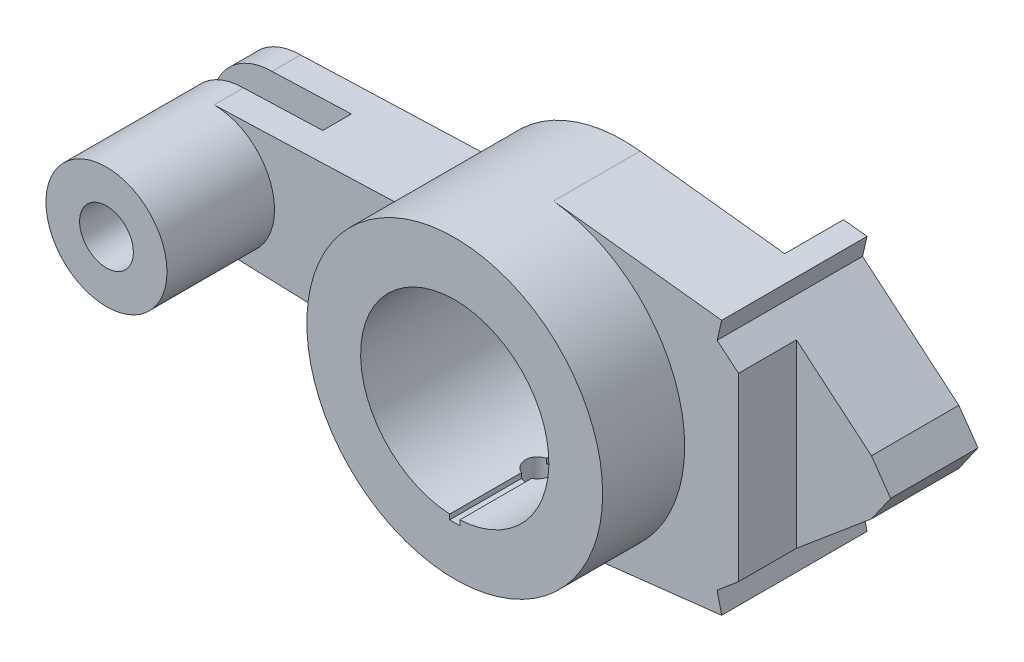
from build123d import *
from OCP.BRepAlgoAPI import BRepAlgoAPI_Cut
from OCP.TopTools import TopTools_ListOfShape

# Parameters (mm, degrees)
BOSS_EXTRUDE7_DEPTH     = 20.6375
SKETCH1_18_R            = 14.2875
SKETCH1_18_R_2          = 6.35
SKETCH1_18_R_3          = 34.925
SKETCH1_18_R_4          = 22.225
BOSS_EXTRUDE10_DEPTH    = 6.746875
BOSS_EXTRUDE11_START    = 6.746875
SKETCH1_20_R            = 34.925
SKETCH1_20_R_2          = 22.225
BOSS_EXTRUDE11_DEPTH    = 6.746875
BOSS_EXTRUDE12_START    = 13.692187
SKETCH1_21_R            = 14.2875
SKETCH1_21_R_2          = 6.35
SKETCH1_21_R_3          = 34.925
SKETCH1_21_R_4          = 22.225
BOSS_EXTRUDE12_DEPTH    = 6.945312
BOSS_EXTRUDE13_START    = 39.09219
SKETCH1_22_R            = 14.2875
SKETCH1_22_R_2          = 6.35
BOSS_EXTRUDE13_DEPTH    = 25.4
BOSS_EXTRUDE14_START    = 13.692187
SKETCH1_23_R            = 34.925
SKETCH1_23_R_2          = 22.225
BOSS_EXTRUDE14_DEPTH    = 19.367501
CUT_EXTRUDE3_DEPTH      = 111.865374
SKETCH5_R               = 3.175
CUT_EXTRUDE4_DEPTH      = 105.575057
CUT_EXTRUDE5_DEPTH      = 105.575057
CUT_EXTRUDE5_DEPTH_BACK = 105.575057
SKETCH6_W               = 33.02
SKETCH6_H               = 6.746875


with BuildPart() as part:
    # Sketch1 → Boss-Extrude7 (new body)
    with BuildSketch(Plane.XY):
        Polygon((38.1, 30.797578), (38.1, -30.797578), (43.65625, -30.1625), (42.588827, -25.538982), (65.327211, -6.459212), (69.85, 0), (65.327211, 6.459212), (42.588827, 25.538982), (43.65625, 30.1625), align=None)
    extrude(amount=-BOSS_EXTRUDE7_DEPTH)

    # Sketch1<18> → Boss-Extrude10 (add)
    # profile 1 of 5: a face of its own
    with BuildSketch(Plane.XY):
        with BuildLine():
            ThreePointArc((34.925, 0), (26.060233, -23.251234), (3.966094, -34.699074))
            Line((3.966094, -34.699074), (38.1, -30.797578))
            Line((38.1, -30.797578), (38.1, 30.797578))
            Line((38.1, 30.797578), (3.966094, 34.699074))
            ThreePointArc((3.966094, 34.699074), (26.060233, 23.251234), (34.925, 0))
        make_face()
    # profile 2 of 5: a face of its own
    with BuildSketch(Plane.XY):
        with BuildLine():
            Line((-55.5625, 15.014068), (-55.5625, -15.014068))
            Line((-55.5625, -15.014068), (-31.10852, -15.875))
            ThreePointArc((-31.10852, -15.875), (-34.925, 0), (-31.10852, 15.875))
            Line((-31.10852, 15.875), (-55.5625, 15.014068))
        make_face()
    # profile 3 of 5: a face of its own
    with BuildSketch(Plane.XY):
        with BuildLine():
            ThreePointArc((-61.9125, 0), (-66.097212, -10.102788), (-76.2, -14.2875))
            Line((-76.2, -14.2875), (-55.5625, -15.014068))
            Line((-55.5625, -15.014068), (-55.5625, 15.014068))
            Line((-55.5625, 15.014068), (-76.2, 14.2875))
            ThreePointArc((-76.2, 14.2875), (-66.097212, 10.102788), (-61.9125, 0))
        make_face()
    # profile 4 of 5: a face of its own
    with BuildSketch(Plane.XY):
        with Locations((-76.2, 0)):
            Circle(SKETCH1_18_R)
        with Locations((-76.2, 0)):
            Circle(SKETCH1_18_R_2, mode=Mode.SUBTRACT)
    # profile 5 of 5: a face of its own
    with BuildSketch(Plane.XY):
        Circle(SKETCH1_18_R_3)
        Circle(SKETCH1_18_R_4, mode=Mode.SUBTRACT)
    extrude(amount=-BOSS_EXTRUDE10_DEPTH)

    # Sketch1<20> → Boss-Extrude11 (add)
    # profile 1 of 5: a face of its own
    with BuildSketch(Plane.XY.offset(BOSS_EXTRUDE11_START)):
        Circle(SKETCH1_20_R)
        Circle(SKETCH1_20_R_2, mode=Mode.SUBTRACT)
    # profile 2 of 5: a face of its own
    with BuildSketch(Plane.XY.offset(BOSS_EXTRUDE11_START)):
        with BuildLine():
            ThreePointArc((34.925, 0), (26.060233, -23.251234), (3.966094, -34.699074))
            Line((3.966094, -34.699074), (38.1, -30.797578))
            Line((38.1, -30.797578), (38.1, 30.797578))
            Line((38.1, 30.797578), (3.966094, 34.699074))
            ThreePointArc((3.966094, 34.699074), (26.060233, 23.251234), (34.925, 0))
        make_face()
    # profile 3 of 5: a face of its own
    with BuildSketch(Plane.XY.offset(BOSS_EXTRUDE11_START)):
        Polygon((38.1, 30.797578), (38.1, -30.797578), (43.65625, -30.1625), (42.588827, -25.538982), (47.625, -21.313131), (47.625, 21.313131), (42.588827, 25.538982), (43.65625, 30.1625), align=None)
    # profile 4 of 5: a face of its own
    with BuildSketch(Plane.XY.offset(BOSS_EXTRUDE11_START)):
        with BuildLine():
            Line((-55.5625, 15.014068), (-55.5625, -15.014068))
            Line((-55.5625, -15.014068), (-31.10852, -15.875))
            ThreePointArc((-31.10852, -15.875), (-34.925, 0), (-31.10852, 15.875))
            Line((-31.10852, 15.875), (-55.5625, 15.014068))
        make_face()
    # profile 5 of 5: a face of its own
    with BuildSketch(Plane.XY.offset(BOSS_EXTRUDE11_START)):
        with BuildLine():
            ThreePointArc((-61.9125, 0), (-66.097212, -10.102788), (-76.2, -14.2875))
            Line((-76.2, -14.2875), (-55.5625, -15.014068))
            Line((-55.5625, -15.014068), (-55.5625, 15.014068))
            Line((-55.5625, 15.014068), (-76.2, 14.2875))
            ThreePointArc((-76.2, 14.2875), (-66.097212, 10.102788), (-61.9125, 0))
        make_face()
    extrude(amount=-BOSS_EXTRUDE11_DEPTH)

    # Sketch1<21> → Boss-Extrude12 (add)
    # profile 1 of 6: a face of its own
    with BuildSketch(Plane.XY.offset(BOSS_EXTRUDE12_START)):
        with Locations((-76.2, 0)):
            Circle(SKETCH1_21_R)
        with Locations((-76.2, 0)):
            Circle(SKETCH1_21_R_2, mode=Mode.SUBTRACT)
    # profile 2 of 6: a face of its own
    with BuildSketch(Plane.XY.offset(BOSS_EXTRUDE12_START)):
        with BuildLine():
            ThreePointArc((-61.9125, 0), (-66.097212, -10.102788), (-76.2, -14.2875))
            Line((-76.2, -14.2875), (-55.5625, -15.014068))
            Line((-55.5625, -15.014068), (-55.5625, 15.014068))
            Line((-55.5625, 15.014068), (-76.2, 14.2875))
            ThreePointArc((-76.2, 14.2875), (-66.097212, 10.102788), (-61.9125, 0))
        make_face()
    # profile 3 of 6: a face of its own
    with BuildSketch(Plane.XY.offset(BOSS_EXTRUDE12_START)):
        with BuildLine():
            Line((-55.5625, 15.014068), (-55.5625, -15.014068))
            Line((-55.5625, -15.014068), (-31.10852, -15.875))
            ThreePointArc((-31.10852, -15.875), (-34.925, 0), (-31.10852, 15.875))
            Line((-31.10852, 15.875), (-55.5625, 15.014068))
        make_face()
    # profile 4 of 6: a face of its own
    with BuildSketch(Plane.XY.offset(BOSS_EXTRUDE12_START)):
        Circle(SKETCH1_21_R_3)
        Circle(SKETCH1_21_R_4, mode=Mode.SUBTRACT)
    # profile 5 of 6: a face of its own
    with BuildSketch(Plane.XY.offset(BOSS_EXTRUDE12_START)):
        with BuildLine():
            ThreePointArc((34.925, 0), (26.060233, -23.251234), (3.966094, -34.699074))
            Line((3.966094, -34.699074), (38.1, -30.797578))
            Line((38.1, -30.797578), (38.1, 30.797578))
            Line((38.1, 30.797578), (3.966094, 34.699074))
            ThreePointArc((3.966094, 34.699074), (26.060233, 23.251234), (34.925, 0))
        make_face()
    # profile 6 of 6: a face of its own
    with BuildSketch(Plane.XY.offset(BOSS_EXTRUDE12_START)):
        Polygon((38.1, 30.797578), (38.1, -30.797578), (43.65625, -30.1625), (42.588827, -25.538982), (47.625, -21.313131), (47.625, 21.313131), (42.588827, 25.538982), (43.65625, 30.1625), align=None)
    extrude(amount=-BOSS_EXTRUDE12_DEPTH)


with BuildPart() as boss_extrude13_tool:
    # Sketch1<22> → Boss-Extrude13 (new body)
    with BuildSketch(Plane.XY.offset(BOSS_EXTRUDE13_START)):
        with Locations(Location((-76.2, 0, 0), (0, 0, 270))):
            Circle(SKETCH1_22_R)
        with Locations((-76.2, 0)):
            Circle(SKETCH1_22_R_2, mode=Mode.SUBTRACT)
    extrude(amount=-BOSS_EXTRUDE13_DEPTH)


with BuildPart() as part_1:
    add(part.part)


with BuildPart() as part_2:
    # Boss-Extrude13: joined with boss_extrude13_tool
    add(part_1.part.fuse(boss_extrude13_tool.part, tol=0.00001))

    # Sketch1<23> → Boss-Extrude14 (add)
    with BuildSketch(Plane.XY.offset(BOSS_EXTRUDE14_START)):
        Circle(SKETCH1_23_R)
        Circle(SKETCH1_23_R_2, mode=Mode.SUBTRACT)
    extrude(amount=BOSS_EXTRUDE14_DEPTH)


with BuildPart() as cut_extrude3_tool:
    # Sketch4 → Cut-Extrude3 (new, through all)
    with BuildSketch(Plane.XY.offset(33.059687)):
        with BuildLine():
            Line((0, -23.38371), (0, -22.225))
            ThreePointArc((0, -22.225), (-0.595526, -22.21702), (-1.190625, -22.193085))
            Line((-1.190625, -22.193085), (-1.190625, -23.38371))
            Line((-1.190625, -23.38371), (0, -23.38371))
        make_face()
        with BuildLine():
            ThreePointArc((1.190625, -22.193085), (0.595526, -22.21702), (0, -22.225))
            Line((0, -22.225), (0, -23.38371))
            Line((0, -23.38371), (1.190625, -23.38371))
            Line((1.190625, -23.38371), (1.190625, -22.193085))
        make_face()
    extrude(amount=-CUT_EXTRUDE3_DEPTH)


with BuildPart() as part_3:
    add(part_2.part)

    # Cut-Extrude3: cut by cut_extrude3_tool, with a tolerance
    cut_extrude3_stock = TopTools_ListOfShape()
    cut_extrude3_stock.Append(part_3.part.wrapped)
    cut_extrude3_tools = TopTools_ListOfShape()
    cut_extrude3_tools.Append(cut_extrude3_tool.part.wrapped)
    cut_extrude3_cut = BRepAlgoAPI_Cut()
    cut_extrude3_cut.SetArguments(cut_extrude3_stock)
    cut_extrude3_cut.SetTools(cut_extrude3_tools)
    cut_extrude3_cut.SetFuzzyValue(0.00001)
    cut_extrude3_cut.Build()
    add(Compound.cast(cut_extrude3_cut.Shape()).solids(), mode=Mode.REPLACE)

    # Sketch5 → Cut-Extrude4 (cut, through all)
    with BuildSketch(Plane(origin=(0, 0, 0), x_dir=(1, 0, 0), z_dir=(0, 1, 0))):
        with Locations(Location((0, -13.156406, 0), (0, 0, 270))):
            Circle(SKETCH5_R)
    extrude(amount=-CUT_EXTRUDE4_DEPTH, mode=Mode.SUBTRACT)

    # Sketch6 → Cut-Extrude5 (cut, two sides: drawn at the far end of the back side and taken through both)
    with BuildSketch(Plane(origin=(0, 0, 0), x_dir=(1, 0, 0), z_dir=(0, 1, 0)).offset(-CUT_EXTRUDE5_DEPTH_BACK)):
        with Locations((-73.9775, -3.373437)):
            Rectangle(SKETCH6_W, SKETCH6_H)
    extrude(amount=CUT_EXTRUDE5_DEPTH + CUT_EXTRUDE5_DEPTH_BACK, mode=Mode.SUBTRACT)


solid = part_3.part
